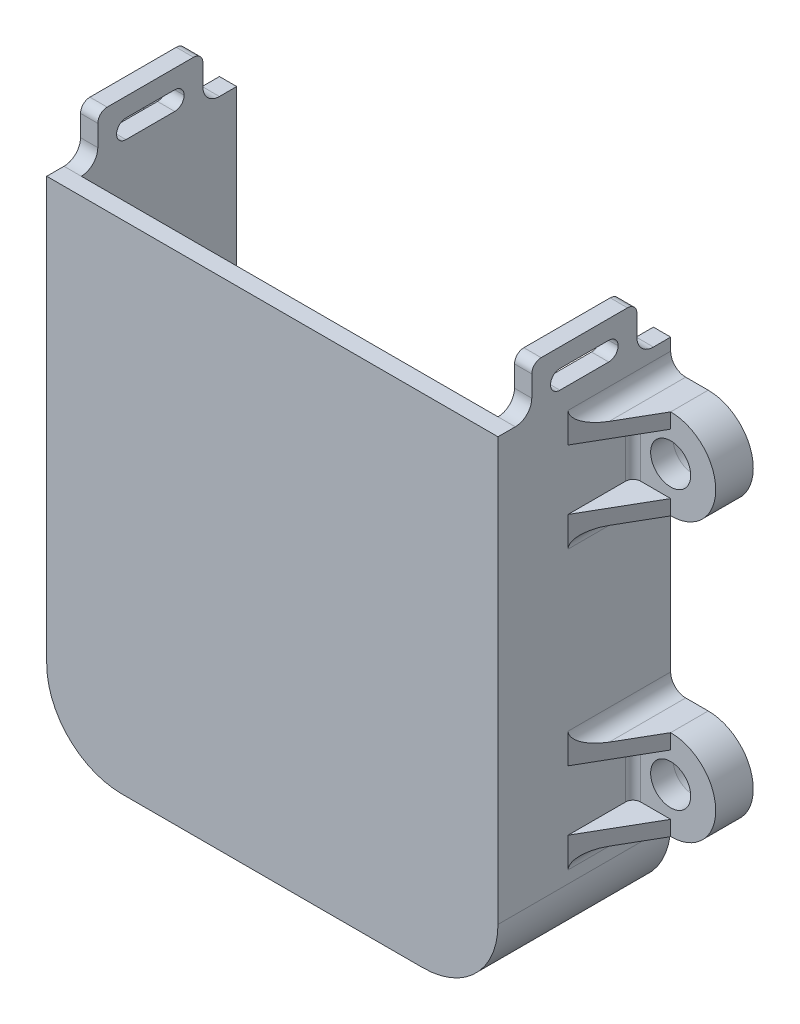
from build123d import *
from OCP.BRepFilletAPI import BRepFilletAPI_MakeChamfer

# Parameters (mm, degrees)
BOSS_EXTRUDE1_DEPTH                        = 29.21
SHELL1_T                                   = -2.921
SKETCH3_W                                  = 50.292
SKETCH3_H                                  = 16.1925
CUT_EXTRUDE2_DEPTH                         = 26.9875
BOSS_EXTRUDE2_DEPTH                        = 6.35
FILLET3_R                                  = 1.27
FILLET4_R                                  = 1.27
RIB1_REACH                                 = 116.892
SKETCH6_WALL_W                             = 244.483688888
SKETCH6_WALL_H                             = 2.54
MIRROR2_COPY_1_REACH                       = 116.892
MIRROR2_COPY_1_SKETCH_W                    = 244.483688888
MIRROR2_COPY_1_SKETCH_H                    = 2.54
MIRROR3_COPY_1_REACH                       = 116.892
MIRROR3_COPY_1_SKETCH_W                    = 244.483688888
MIRROR3_COPY_1_SKETCH_H                    = 2.54
MIRROR3_COPY_2_REACH                       = 116.892
MIRROR3_COPY_2_SKETCH_W                    = 244.483688888
MIRROR3_COPY_2_SKETCH_H                    = 2.54
MIRROR3_COPY_3_REACH                       = 116.892
MIRROR3_COPY_3_SKETCH_W                    = 244.483688888
MIRROR3_COPY_3_SKETCH_H                    = 2.54
FILLET6_R                                  = 2.54
SKETCH7_R                                  = 3.3909
CUT_EXTRUDE3_DEPTH                         = 6.35
MIRROR4_AT_THE_SECOND_PLANE_COPY_1_SKETC_R = 3.3909
MIRROR4_AT_THE_SECOND_PLANE_COPY_1_DEPTH   = 6.35
CHAMFER1_SIZE                              = 2.54
CHAMFER1_SIZE2                             = 0.35697372
SKETCH10_W                                 = 17.78
SKETCH10_H                                 = 7.9375
BOSS_EXTRUDE3_DEPTH                        = 2.921
SKETCH11_W                                 = 11.43
SKETCH11_H                                 = 3.175
CUT_EXTRUDE4_DEPTH                         = 2.921
FILLET7_R                                  = 1.5875
FILLET7_OF_MIRROR5_R                       = 1.5875
FILLET8_R                                  = 2.794


with BuildPart() as part:
    # Sketch1 → Boss-Extrude1 (new body)
    with BuildSketch(Plane.XY):
        with BuildLine():
            Line((0, 0), (50.927, 0))
            ThreePointArc((50.927, 0), (59.907256121, 3.719743879), (63.627, 12.7))
            Line((63.627, 12.7), (63.627, 84.1375))
            Line((63.627, 84.1375), (-12.7, 84.1375))
            Line((-12.7, 84.1375), (-12.7, 12.7))
            ThreePointArc((-12.7, 12.7), (-8.980256121, 3.719743879), (0, 0))
        make_face()
    extrude(amount=-BOSS_EXTRUDE1_DEPTH)

    # Shell1
    shell1_openings = [part.faces().sort_by_distance(p)[0] for p in [
        (25.4635, 42.496263873, -29.21),
        (25.4635, 84.1375, -14.605),
    ]]
    offset(amount=SHELL1_T, openings=shell1_openings, kind=Kind.INTERSECTION)

    # Sketch3 → Cut-Extrude2 (cut)
    with BuildSketch(Plane(origin=(0, 0, 0), x_dir=(-1, 0, 0), z_dir=(0, -1, 0))):
        with Locations((-17.2085, 11.27125)):
            Rectangle(SKETCH3_W, SKETCH3_H)
    extrude(amount=-CUT_EXTRUDE2_DEPTH, mode=Mode.SUBTRACT)

    # Sketch4 → Boss-Extrude2 (add)
    with BuildSketch(Plane(origin=(0, 0, -29.21), x_dir=(-1, 0, 0), z_dir=(0, 0, -1))):
        with BuildLine():
            Line((12.7, 17.30375), (19.05, 17.30375))
            ThreePointArc((19.05, 17.30375), (26.67, 24.92375), (19.05, 32.54375))
            Line((19.05, 32.54375), (12.7, 32.54375))
            Line((12.7, 32.54375), (12.7, 17.30375))
        make_face()
        with BuildLine():
            Line((12.7, 79.53375), (19.05, 79.53375))
            ThreePointArc((19.05, 79.53375), (26.67, 71.91375), (19.05, 64.29375))
            Line((19.05, 64.29375), (12.7, 64.29375))
            Line((12.7, 64.29375), (12.7, 79.53375))
        make_face()
        with BuildLine():
            Line((-63.627, 79.53375), (-69.977, 79.53375))
            ThreePointArc((-69.977, 79.53375), (-77.597, 71.91375), (-69.977, 64.29375))
            Line((-69.977, 64.29375), (-63.627, 64.29375))
            Line((-63.627, 64.29375), (-63.627, 79.53375))
        make_face()
        with BuildLine():
            Line((-63.627, 32.54375), (-69.977, 32.54375))
            ThreePointArc((-69.977, 32.54375), (-77.597, 24.92375), (-69.977, 17.30375))
            Line((-69.977, 17.30375), (-63.627, 17.30375))
            Line((-63.627, 17.30375), (-63.627, 32.54375))
        make_face()
    extrude(amount=-BOSS_EXTRUDE2_DEPTH)

    # Fillet3
    fillet3_edges = [part.edges().sort_by_distance(p)[0] for p in [
        (-12.7, 24.92375, -22.86),
        (-12.7, 71.91375, -22.86),
        (63.627, 71.91375, -22.86),
        (63.627, 24.92375, -22.86),
    ]]
    fillet(fillet3_edges, radius=FILLET3_R)

    # Fillet4
    fillet4_edges = [part.edges().sort_by_distance(p)[0] for p in [
        (-7.9375, 4.88712078, -19.3675),
        (42.3545, 1.4605, -3.175),
        (42.3545, 1.4605, -19.3675),
        (-7.9375, 4.88712078, -3.175),
    ]]
    fillet(fillet4_edges, radius=FILLET4_R)

    # Sketch6 wall → Rib1 (add, up to next)
    with BuildSketch(Plane(origin=(66.802, 79.53375, -17.360738686), x_dir=(-0.500000000002, 0, 0.866025403783), z_dir=(0.866025403783, 0, 0.500000000002)), mode=Mode.PRIVATE) as rib1_sk1:
        with Locations((0, 1.27)):
            Rectangle(SKETCH6_WALL_W, SKETCH6_WALL_H)
    rib1_tool1 = extrude(rib1_sk1.sketch, amount=-RIB1_REACH, mode=Mode.PRIVATE) - part.part
    rib1 = rib1_tool1.solids().sort_by_distance((66.802, 79.53375, -17.360738686))[0]
    add(rib1)

    # Mirror1: Rib1 across plane
    add(rib1.mirror(Plane.ZX.offset(71.91375)))

    # Mirror2: Rib1 across plane
    add(rib1.mirror(Plane(origin=(0, 48.41875, 0), x_dir=(0, 0, 1), z_dir=(0, -1, 0))))

    # Mirror2 copy 1 sketch → Mirror2 copy 1 (add, up to next)
    with BuildSketch(Plane(origin=(66.802, 32.54375, -17.360738686), x_dir=(-0.500000000002, 0, 0.866025403783), z_dir=(0.866025403783, 0, 0.500000000002)), mode=Mode.PRIVATE) as mirror2_copy_1_sk1:
        with Locations((0, 1.27)):
            Rectangle(MIRROR2_COPY_1_SKETCH_W, MIRROR2_COPY_1_SKETCH_H)
    mirror2_copy_1_tool1 = extrude(mirror2_copy_1_sk1.sketch, amount=-MIRROR2_COPY_1_REACH, mode=Mode.PRIVATE) - part.part
    add(mirror2_copy_1_tool1.solids().sort_by_distance((66.802, 32.54375, -17.360738686))[0])

    # Mirror3: Rib1 across plane
    add(rib1.mirror(Plane(origin=(25.4635, 0, 0), x_dir=(0, 0, 1), z_dir=(1, 0, 0))))

    # Mirror3 copy 1 sketch → Mirror3 copy 1 (add, up to next)
    with BuildSketch(Plane(origin=(-15.875, 64.29375, -17.360738686), x_dir=(0.500000000002, 0, 0.866025403783), z_dir=(-0.866025403783, 0, 0.500000000002)), mode=Mode.PRIVATE) as mirror3_copy_1_sk1:
        with Locations((0, 1.27)):
            Rectangle(MIRROR3_COPY_1_SKETCH_W, MIRROR3_COPY_1_SKETCH_H)
    mirror3_copy_1_tool1 = extrude(mirror3_copy_1_sk1.sketch, amount=-MIRROR3_COPY_1_REACH, mode=Mode.PRIVATE) - part.part
    add(mirror3_copy_1_tool1.solids().sort_by_distance((-15.875, 64.29375, -17.360738686))[0])

    # Mirror3 copy 2 sketch → Mirror3 copy 2 (add, up to next)
    with BuildSketch(Plane(origin=(-15.875, 17.30375, -17.360738686), x_dir=(0.500000000002, 0, 0.866025403783), z_dir=(-0.866025403783, 0, 0.500000000002)), mode=Mode.PRIVATE) as mirror3_copy_2_sk1:
        with Locations((0, 1.27)):
            Rectangle(MIRROR3_COPY_2_SKETCH_W, MIRROR3_COPY_2_SKETCH_H)
    mirror3_copy_2_tool1 = extrude(mirror3_copy_2_sk1.sketch, amount=-MIRROR3_COPY_2_REACH, mode=Mode.PRIVATE) - part.part
    add(mirror3_copy_2_tool1.solids().sort_by_distance((-15.875, 17.30375, -17.360738686))[0])

    # Mirror3 copy 3 sketch → Mirror3 copy 3 (add, up to next)
    with BuildSketch(Plane(origin=(-15.875, 32.54375, -17.360738686), x_dir=(0.500000000002, 0, 0.866025403783), z_dir=(-0.866025403783, 0, 0.500000000002)), mode=Mode.PRIVATE) as mirror3_copy_3_sk1:
        with Locations((0, -1.27)):
            Rectangle(MIRROR3_COPY_3_SKETCH_W, MIRROR3_COPY_3_SKETCH_H)
    mirror3_copy_3_tool1 = extrude(mirror3_copy_3_sk1.sketch, amount=-MIRROR3_COPY_3_REACH, mode=Mode.PRIVATE) - part.part
    add(mirror3_copy_3_tool1.solids().sort_by_distance((-15.875, 32.54375, -17.360738686))[0])

    # Fillet6
    fillet6_edges = [part.edges().sort_by_distance(p)[0] for p in [
        (-12.7, 17.30375, -20.535738686),
        (-12.7, 32.54375, -20.535738686),
        (-12.7, 64.29375, -20.535738686),
        (-12.7, 79.53375, -20.535738686),
        (63.627, 79.53375, -20.535738686),
        (63.627, 64.29375, -20.535738686),
        (63.627, 32.54375, -20.535738686),
        (63.627, 17.30375, -20.535738686),
    ]]
    fillet(fillet6_edges, radius=FILLET6_R)

    # Sketch7 → Cut-Extrude3 (cut)
    with BuildSketch(Plane.XY.offset(-22.86)):
        with Locations((69.977, 71.91375)):
            Circle(SKETCH7_R)
    cut_extrude3 = extrude(amount=-CUT_EXTRUDE3_DEPTH, mode=Mode.SUBTRACT)

    # Mirror4: Cut-Extrude3 across plane
    add(cut_extrude3.mirror(Plane(origin=(25.4635, 0, 0), x_dir=(0, 0, 1), z_dir=(1, 0, 0))), mode=Mode.SUBTRACT)

    # Mirror4 at the second plane: Cut-Extrude3 across plane
    add(cut_extrude3.mirror(Plane(origin=(0, 48.41875, 0), x_dir=(0, 0, 1), z_dir=(0, -1, 0))), mode=Mode.SUBTRACT)

    # Mirror4 at the second plane copy 1 sketc → Mirror4 at the second plane copy 1 (cut)
    with BuildSketch(Plane(origin=(50.927, 96.8375, -22.86), x_dir=(-1, 0, 0), z_dir=(0, 0, 1))):
        with Locations((69.977, 71.91375)):
            Circle(MIRROR4_AT_THE_SECOND_PLANE_COPY_1_SKETC_R)
    extrude(amount=-MIRROR4_AT_THE_SECOND_PLANE_COPY_1_DEPTH, mode=Mode.SUBTRACT)

    # Chamfer1: one chamfer whose edges measure the first distance from different faces: ONE call of the kernel's chamfer builder (chamfer() names one face for all edges)
    chamfer1_edges_1 = [part.edges().sort_by_distance(p)[0] for p in [
        (66.5861, 71.91375, -29.21),
    ]]
    chamfer1_side_1 = [part.faces().sort_by_distance(p)[0] for p in [
        (66.5861, 71.91375, -26.035),
    ]]
    chamfer1_edges_2 = [part.edges().sort_by_distance(p)[0] for p in [
        (66.5861, 24.92375, -29.21),
    ]]
    chamfer1_side_2 = [part.faces().sort_by_distance(p)[0] for p in [
        (66.5861, 24.92375, -26.035),
    ]]
    chamfer1_edges_3 = [part.edges().sort_by_distance(p)[0] for p in [
        (-15.6591, 71.91375, -29.21),
    ]]
    chamfer1_side_3 = [part.faces().sort_by_distance(p)[0] for p in [
        (-15.6591, 71.91375, -26.035),
    ]]
    chamfer1_edges_4 = [part.edges().sort_by_distance(p)[0] for p in [
        (-15.6591, 24.92375, -29.21),
    ]]
    chamfer1_side_4 = [part.faces().sort_by_distance(p)[0] for p in [
        (-15.6591, 24.92375, -26.035),
    ]]
    chamfer1 = BRepFilletAPI_MakeChamfer(part.part.solid().wrapped)
    for e in chamfer1_edges_1:
        chamfer1.Add(CHAMFER1_SIZE, CHAMFER1_SIZE2, e.wrapped, chamfer1_side_1[0].wrapped)  # the first distance lies on this face
    for e in chamfer1_edges_2:
        chamfer1.Add(CHAMFER1_SIZE, CHAMFER1_SIZE2, e.wrapped, chamfer1_side_2[0].wrapped)  # the first distance lies on this face
    for e in chamfer1_edges_3:
        chamfer1.Add(CHAMFER1_SIZE, CHAMFER1_SIZE2, e.wrapped, chamfer1_side_3[0].wrapped)  # the first distance lies on this face
    for e in chamfer1_edges_4:
        chamfer1.Add(CHAMFER1_SIZE, CHAMFER1_SIZE2, e.wrapped, chamfer1_side_4[0].wrapped)  # the first distance lies on this face
    add(Compound.cast(chamfer1.Shape()), mode=Mode.REPLACE)

    # Sketch10 → Boss-Extrude3 (add)
    with BuildSketch(Plane(origin=(63.627, 0, 0), x_dir=(0, 0, -1), z_dir=(1, 0, 0))):
        with Locations((14.605, 88.10625)):
            Rectangle(SKETCH10_W, SKETCH10_H)
    boss_extrude3 = extrude(amount=-BOSS_EXTRUDE3_DEPTH)

    # Sketch11 → Cut-Extrude4 (cut)
    with BuildSketch(Plane(origin=(63.627, 0, 0), x_dir=(0, 0, -1), z_dir=(1, 0, 0))):
        with Locations((14.605, 87.3125)):
            Rectangle(SKETCH11_W, SKETCH11_H)
    cut_extrude4 = extrude(amount=-CUT_EXTRUDE4_DEPTH, mode=Mode.SUBTRACT)

    # Fillet7
    fillet7_edges = [part.edges().sort_by_distance(p)[0] for p in [
        (62.1665, 85.725, -8.89),
        (62.1665, 88.9, -8.89),
        (62.1665, 88.9, -20.32),
        (62.1665, 85.725, -20.32),
        (62.1665, 92.075, -23.495),
        (62.1665, 92.075, -5.715),
    ]]
    fillet(fillet7_edges, radius=FILLET7_R - 0.0001)  # a hair under: the kernel refuses the full size

    # Mirror5: Boss-Extrude3, Cut-Extrude4 across plane
    add(boss_extrude3.mirror(Plane(origin=(25.4635, 0, 0), x_dir=(0, 0, 1), z_dir=(1, 0, 0))))
    add(cut_extrude4.mirror(Plane(origin=(25.4635, 0, 0), x_dir=(0, 0, 1), z_dir=(1, 0, 0))), mode=Mode.SUBTRACT)

    # Fillet7 of Mirror5
    fillet7_of_mirror5_edges = [part.edges().sort_by_distance(p)[0] for p in [
        (-11.2395, 85.725, -8.89),
        (-11.2395, 88.9, -8.89),
        (-11.2395, 88.9, -20.32),
        (-11.2395, 85.725, -20.32),
        (-11.2395, 92.075, -23.495),
        (-11.2395, 92.075, -5.715),
    ]]
    fillet(fillet7_of_mirror5_edges, radius=FILLET7_OF_MIRROR5_R - 0.0001)  # a hair under: the kernel refuses the full size

    # Fillet8
    fillet8_edges = [part.edges().sort_by_distance(p)[0] for p in [
        (62.1665, 84.1375, -5.715),
        (62.1665, 84.1375, -23.495),
        (-11.2395, 84.1375, -5.715),
        (-11.2395, 84.1375, -23.495),
    ]]
    fillet(fillet8_edges, radius=FILLET8_R)


solid = part.part
